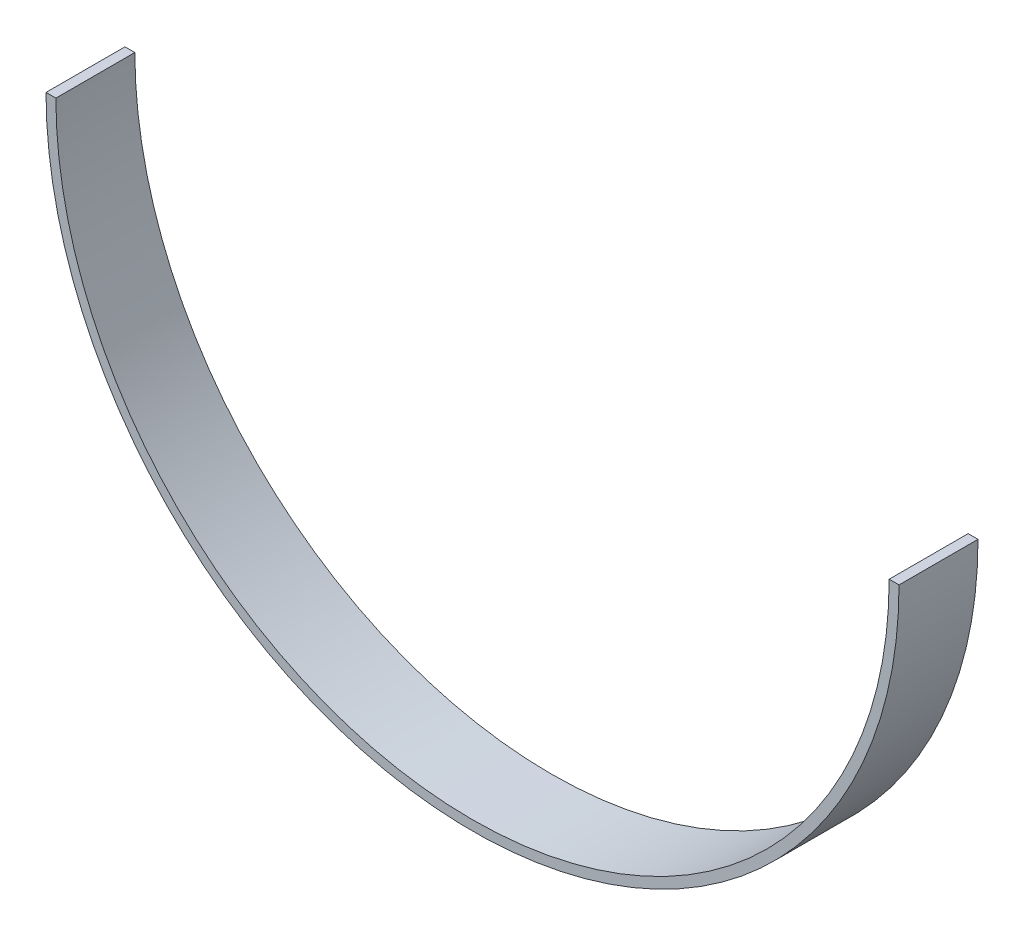
from build123d import *

# Parameters (mm, degrees)
BASE_FLANGE1_DEPTH = 63.5


# Sheet-metal steps are written as plain solids
with BuildPart() as part:
    # Sketch1 → Base-Flange1 (new body)
    with BuildSketch(Plane.XY):
        with BuildLine():
            ThreePointArc((-335.026, 0), (0, -335.026), (335.026, 0))
            Line((335.026, 0), (342.9635, 0))
            ThreePointArc((342.9635, 0), (0, -342.9635), (-342.9635, 0))
            Line((-342.9635, 0), (-335.026, 0))
        make_face()
    extrude(amount=BASE_FLANGE1_DEPTH)


solid = part.part
